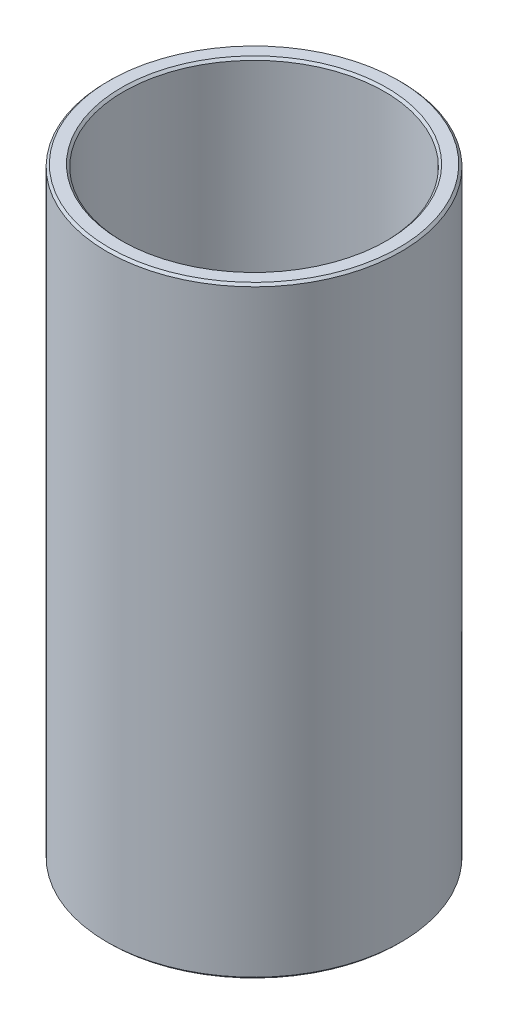
from build123d import *

# Parameters (mm, degrees)
SKETCH1_R           = 37.5
BOSS_EXTRUDE1_DEPTH = 153.642745413
SKETCH2_R           = 33.253749079
CUT_EXTRUDE1_DEPTH  = 163.537974695
CHAMFER1_SIZE       = 0.580031588


with BuildPart() as part:
    # Sketch1 → Boss-Extrude1 (new body)
    with BuildSketch(Plane(origin=(0, 0, 0), x_dir=(1, 0, 0), z_dir=(0, 1, 0))):
        Circle(SKETCH1_R)
    extrude(amount=BOSS_EXTRUDE1_DEPTH)

    # Sketch2 → Cut-Extrude1 (cut, through all)
    with BuildSketch(Plane(origin=(0, 0, 0), x_dir=(1, 0, 0), z_dir=(0, 1, 0))):
        Circle(SKETCH2_R)
    extrude(amount=CUT_EXTRUDE1_DEPTH, mode=Mode.SUBTRACT)

    # Chamfer1
    chamfer1_edges = [part.edges().sort_by_distance(p)[0] for p in [
        (-33.253749079, 153.642745413, 0),
        (-33.253749079, 0, 0),
        (-37.5, 0, 0),
        (-37.5, 153.642745413, 0),
    ]]
    chamfer(chamfer1_edges, length=CHAMFER1_SIZE)


solid = part.part
